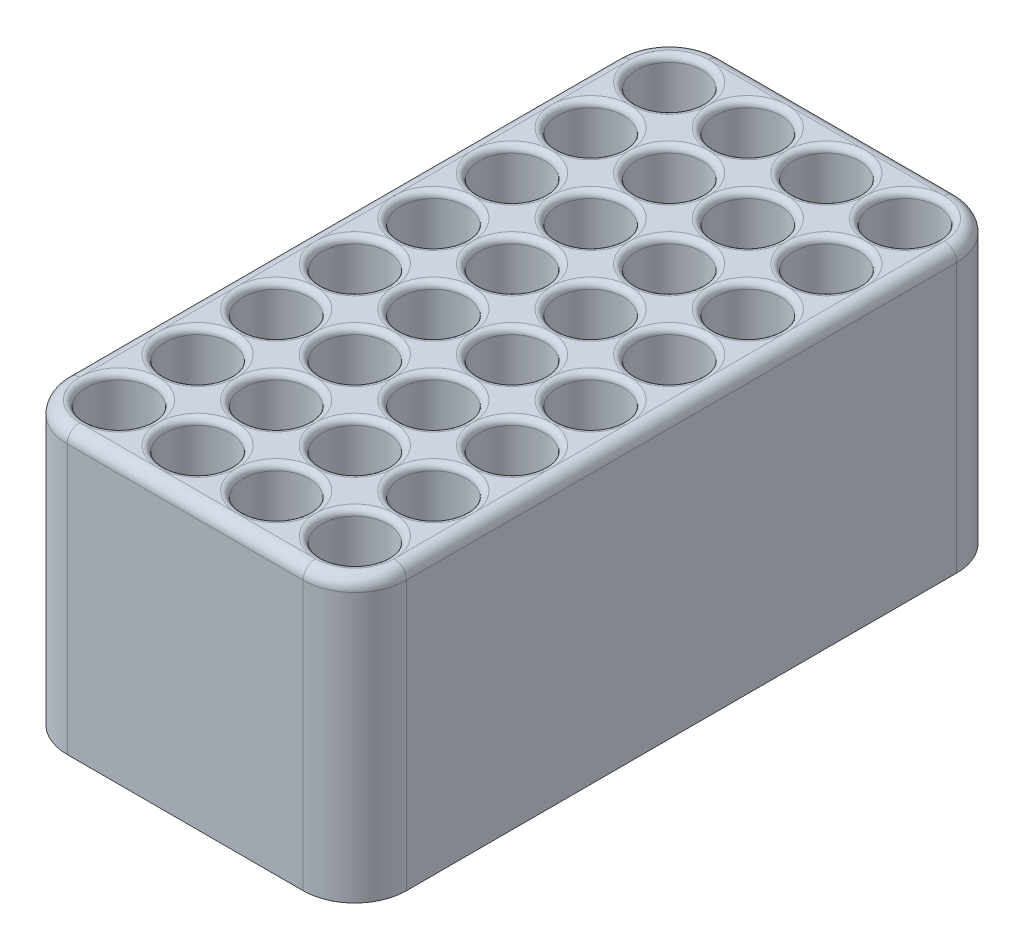
from build123d import *

# Parameters (mm, degrees)
SKETCH1_W                                  = 15.08125
SKETCH1_H                                  = 15.08125
SKETCH1_R                                  = 6.35
BOSS_EXTRUDE1_DEPTH                        = 50.8
SKETCH4_W                                  = 15.08125
SKETCH4_H                                  = 15.08125
BOSS_EXTRUDE4_DEPTH                        = 3.175
FILLET3_R                                  = 1.190625
LPATTERN2_COUNT                            = 4
LPATTERN2_PITCH                            = 15.08125
LPATTERN2_COUNT_DIR2                       = 8
LPATTERN2_PITCH_DIR2                       = 15.08125
FILLET3_OF_LPATTERN2_R                     = 1.190625
SKETCH5_W                                  = 65.0875
SKETCH5_H                                  = 125.4125
SKETCH5_W_2                                = 60.325
SKETCH5_H_2                                = 120.65
BOSS_EXTRUDE5_DEPTH                        = 53.975
FILLET4_R                                  = 9.921875
FILLET5_R                                  = 2.38125
CSK_FOR_10_FLAT_HEAD_MACHINE_SCREW_2_COUNT = 2
CSK_FOR_10_FLAT_HEAD_MACHINE_SCREW_2_PITCH = 54.376220173
CSK_FOR_10_FLAT_HEAD_MACHINE_SCREW_3_COUNT = 2
CSK_FOR_10_FLAT_HEAD_MACHINE_SCREW_3_PITCH = 114.855378153
CSK_FOR_10_FLAT_HEAD_MACHINE_SCREW_4_COUNT = 2
CSK_FOR_10_FLAT_HEAD_MACHINE_SCREW_4_PITCH = 75.40625


with BuildPart() as part:
    # Sketch1 → Boss-Extrude1 (new body)
    with BuildSketch(Plane(origin=(0, 0, 0), x_dir=(1, 0, 0), z_dir=(0, 1, 0))):
        Rectangle(SKETCH1_W, SKETCH1_H)
        with Locations(Location((0, 0, 0), (0, 0, 270))):
            Circle(SKETCH1_R, mode=Mode.SUBTRACT)
    boss_extrude1 = extrude(amount=BOSS_EXTRUDE1_DEPTH)

    # Sketch4 → Boss-Extrude4 (add)
    with BuildSketch(Plane.XZ):
        Rectangle(SKETCH4_W, SKETCH4_H)
    boss_extrude4 = extrude(amount=BOSS_EXTRUDE4_DEPTH)

    # Fillet3
    fillet3_edges = [part.edges().sort_by_distance(p)[0] for p in [
        (0, 0, -6.35),
        (0, 50.8, -6.35),
    ]]
    fillet(fillet3_edges, radius=FILLET3_R - 0.0001)  # a hair under: the kernel refuses the full size

    # LPattern2: Boss-Extrude1, Boss-Extrude4 4 × 8
    with Locations(*[(i * LPATTERN2_PITCH, 0, j * LPATTERN2_PITCH_DIR2) for i in range(LPATTERN2_COUNT) for j in range(LPATTERN2_COUNT_DIR2) if (i, j) != (0, 0)]):
        add(boss_extrude1)
        add(boss_extrude4)

    # Fillet3 of LPattern2
    fillet3_of_lpattern2_edges = [part.edges().sort_by_distance(p)[0] for p in [
        (0, 0, 8.73125),
        (0, 50.8, 8.73125),
        (0, 0, 23.8125),
        (0, 50.8, 23.8125),
        (0, 0, 38.89375),
        (0, 50.8, 38.89375),
        (0, 0, 53.975),
        (0, 50.8, 53.975),
        (0, 0, 69.05625),
        (0, 50.8, 69.05625),
        (0, 0, 84.1375),
        (0, 50.8, 84.1375),
        (0, 0, 99.21875),
        (0, 50.8, 99.21875),
        (15.08125, 0, -6.35),
        (15.08125, 50.8, -6.35),
        (15.08125, 0, 8.73125),
        (15.08125, 50.8, 8.73125),
        (15.08125, 0, 23.8125),
        (15.08125, 50.8, 23.8125),
        (15.08125, 0, 38.89375),
        (15.08125, 50.8, 38.89375),
        (15.08125, 0, 53.975),
        (15.08125, 50.8, 53.975),
        (15.08125, 0, 69.05625),
        (15.08125, 50.8, 69.05625),
        (15.08125, 0, 84.1375),
        (15.08125, 50.8, 84.1375),
        (15.08125, 0, 99.21875),
        (15.08125, 50.8, 99.21875),
        (30.1625, 0, -6.35),
        (30.1625, 50.8, -6.35),
        (30.1625, 0, 8.73125),
        (30.1625, 50.8, 8.73125),
        (30.1625, 0, 23.8125),
        (30.1625, 50.8, 23.8125),
        (30.1625, 0, 38.89375),
        (30.1625, 50.8, 38.89375),
        (30.1625, 0, 53.975),
        (30.1625, 50.8, 53.975),
        (30.1625, 0, 69.05625),
        (30.1625, 50.8, 69.05625),
        (30.1625, 0, 84.1375),
        (30.1625, 50.8, 84.1375),
        (30.1625, 0, 99.21875),
        (30.1625, 50.8, 99.21875),
        (45.24375, 0, -6.35),
        (45.24375, 50.8, -6.35),
        (45.24375, 0, 8.73125),
        (45.24375, 50.8, 8.73125),
        (45.24375, 0, 23.8125),
        (45.24375, 50.8, 23.8125),
        (45.24375, 0, 38.89375),
        (45.24375, 50.8, 38.89375),
        (45.24375, 0, 53.975),
        (45.24375, 50.8, 53.975),
        (45.24375, 0, 69.05625),
        (45.24375, 50.8, 69.05625),
        (45.24375, 0, 84.1375),
        (45.24375, 50.8, 84.1375),
        (45.24375, 0, 99.21875),
        (45.24375, 50.8, 99.21875),
    ]]
    fillet(fillet3_of_lpattern2_edges, radius=FILLET3_OF_LPATTERN2_R - 0.0001)  # a hair under: the kernel refuses the full size

    # Sketch5 → Boss-Extrude5 (add)
    with BuildSketch(Plane.XZ.offset(3.175)):
        with Locations((22.621875, 52.784375)):
            Rectangle(SKETCH5_W, SKETCH5_H)
        with Locations((22.621875, 52.784375)):
            Rectangle(SKETCH5_W_2, SKETCH5_H_2, mode=Mode.SUBTRACT)
    extrude(amount=-BOSS_EXTRUDE5_DEPTH)

    # Fillet4
    fillet4_edges = [part.edges().sort_by_distance(p)[0] for p in [
        (-9.921875, 23.8125, -9.921875),
        (55.165625, 23.8125, -9.921875),
        (55.165625, 23.8125, 115.490625),
        (-9.921875, 23.8125, 115.490625),
    ]]
    fillet(fillet4_edges, radius=FILLET4_R)

    # Fillet5
    fillet5_edges = [part.edges().sort_by_distance(p)[0] for p in [
        (22.621875, 50.8, 115.490625),
        (-9.921875, 50.8, 52.784375),
        (55.165625, 50.8, 52.784375),
        (22.621875, 50.8, -9.921875),
        (-7.015825095, 50.8, -7.015825095),
        (52.259575095, 50.8, -7.015825095),
        (52.259575095, 50.8, 112.584575095),
        (-7.015825095, 50.8, 112.584575095),
    ]]
    fillet(fillet5_edges, radius=FILLET5_R)

    # Sketch7 → CSK for #10 Flat Head Machine Screw (100)1 (revolve, cut)
    with BuildSketch(Plane(origin=(45.24375, 0, 0), x_dir=(0, 0, 1), z_dir=(1, 0, 0))):
        Polygon((0, 0), (0, 3.175), (2.5527, 3.175), (2.5527, 1.960808018), (4.8895, 0), align=None)
    csk_for_10_flat_head_machine_screw_100 = revolve(axis=Axis((45.24375, 6.35, 0), (0, -1, 0)), mode=Mode.SUBTRACT)

    # CSK for _10 Flat Head Machine Screw  2: CSK for #10 Flat Head Machine Screw (100)1 ×2
    with Locations(*[Vector(-0.8320502943378437, 0, 0.5547001962252291) * (i * CSK_FOR_10_FLAT_HEAD_MACHINE_SCREW_2_PITCH) for i in range(1, CSK_FOR_10_FLAT_HEAD_MACHINE_SCREW_2_COUNT)]):
        add(csk_for_10_flat_head_machine_screw_100, mode=Mode.SUBTRACT)

    # CSK for _10 Flat Head Machine Screw  3: CSK for #10 Flat Head Machine Screw (100)1 ×2
    with Locations(*[Vector(-0.3939192985791677, 0, 0.9191450300180579) * (i * CSK_FOR_10_FLAT_HEAD_MACHINE_SCREW_3_PITCH) for i in range(1, CSK_FOR_10_FLAT_HEAD_MACHINE_SCREW_3_COUNT)]):
        add(csk_for_10_flat_head_machine_screw_100, mode=Mode.SUBTRACT)

    # CSK for _10 Flat Head Machine Screw  4: CSK for #10 Flat Head Machine Screw (100)1 ×2
    with Locations(*[(0, 0, i * CSK_FOR_10_FLAT_HEAD_MACHINE_SCREW_4_PITCH) for i in range(1, CSK_FOR_10_FLAT_HEAD_MACHINE_SCREW_4_COUNT)]):
        add(csk_for_10_flat_head_machine_screw_100, mode=Mode.SUBTRACT)


solid = part.part
